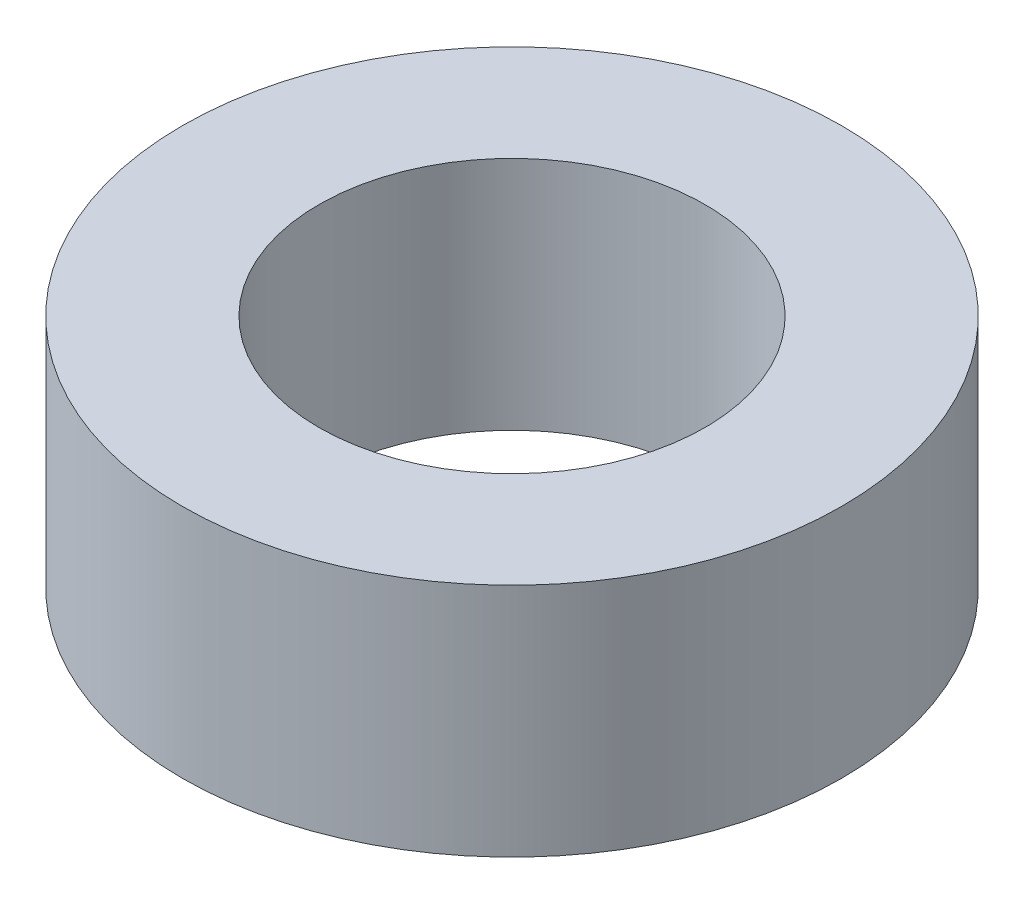
from build123d import *

# Parameters (mm, degrees)
SKETCH_1_R      = 7
SKETCH_1_R_2    = 4.1
EXTRUDE_1_DEPTH = 5


with BuildPart() as part:
    # 草图1 → 凸台-拉伸1 (new body)
    with BuildSketch(Plane(origin=(0, 0, 0), x_dir=(1, 0, 0), z_dir=(0, 1, 0))):
        Circle(SKETCH_1_R)
        Circle(SKETCH_1_R_2, mode=Mode.SUBTRACT)
    extrude(amount=EXTRUDE_1_DEPTH)


solid = part.part
